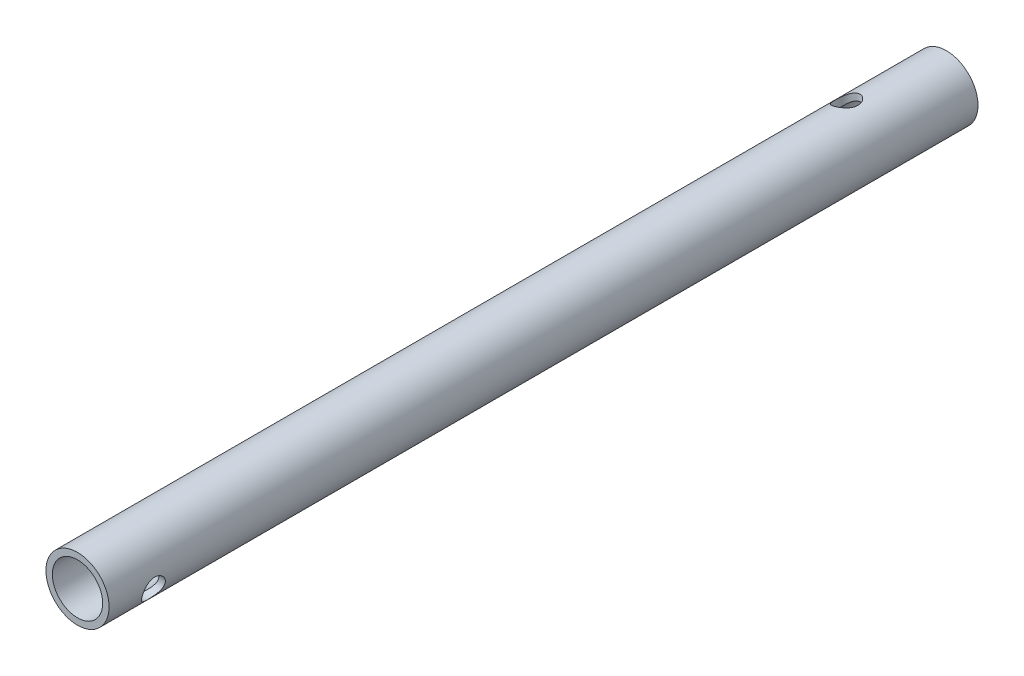
from build123d import *

# Parameters (mm, degrees)
SKETCH3_R           = 17.526
SKETCH3_R_2         = 13.97
BOSS_EXTRUDE1_DEPTH = 241.3
SKETCH4_R           = 6.35
CUT_EXTRUDE1_DEPTH  = 246.179511128
SKETCH5_R           = 6.35
CUT_EXTRUDE2_DEPTH  = 246.17951125


with BuildPart() as part:
    # Sketch3 → Boss-Extrude1 (new, symmetric)
    with BuildSketch(Plane.XY):
        Circle(SKETCH3_R)
        Circle(SKETCH3_R_2, mode=Mode.SUBTRACT)
    extrude(amount=BOSS_EXTRUDE1_DEPTH, both=True)

    # Sketch4 → Cut-Extrude1 (cut, through all)
    with BuildSketch(Plane(origin=(0, 22.225, 0), x_dir=(1, 0, 0), z_dir=(0, 1, 0))):
        with Locations((-4.699, 190.5)):
            Circle(SKETCH4_R)
    extrude(amount=-CUT_EXTRUDE1_DEPTH, mode=Mode.SUBTRACT)

    # Sketch5 → Cut-Extrude2 (cut, through all)
    with BuildSketch(Plane(origin=(22.225, 0, 0), x_dir=(0, 0, -1), z_dir=(1, 0, 0))):
        with Locations((-215.9, -4.699)):
            Circle(SKETCH5_R)
    extrude(amount=-CUT_EXTRUDE2_DEPTH, mode=Mode.SUBTRACT)


solid = part.part
